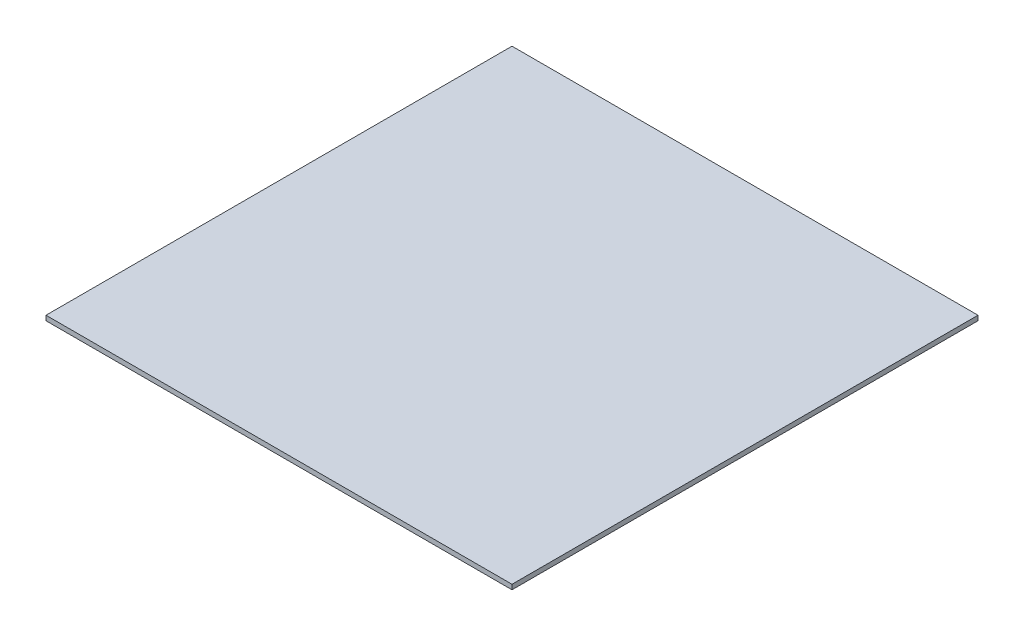
from build123d import *

# Parameters (mm, degrees)
SKETCH1_W           = 152.4
SKETCH1_H           = 152.4
BOSS_EXTRUDE1_DEPTH = 1.5748


with BuildPart() as part:
    # Sketch1 → Boss-Extrude1 (new body)
    with BuildSketch(Plane(origin=(0, 0, 0), x_dir=(1, 0, 0), z_dir=(0, 1, 0))):
        Rectangle(SKETCH1_W, SKETCH1_H)
    extrude(amount=BOSS_EXTRUDE1_DEPTH)


solid = part.part
